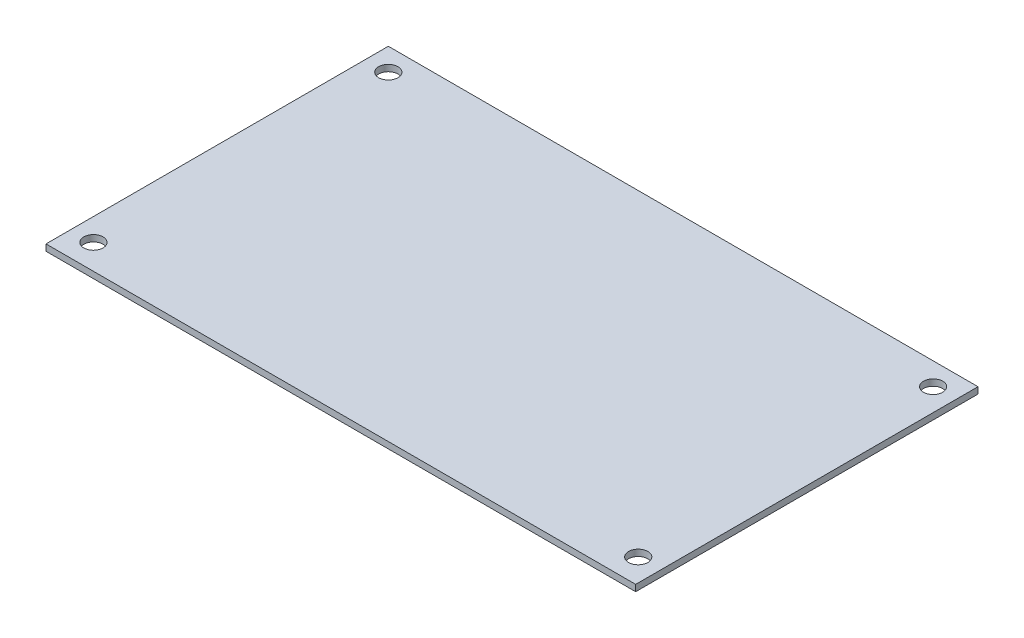
from build123d import *

# Parameters (mm, degrees)
SKETCH_1_W          = 92
SKETCH_1_H          = 53.41
EXTRUDE_1_DEPTH     = 1
SKETCH_2_R          = 1.5
CUT_EXTRUDE_1_DEPTH = 10


with BuildPart() as part:
    # Эскиз1 → Бобышка-Вытянуть1 (new body)
    with BuildSketch(Plane(origin=(0, 0, 0), x_dir=(1, 0, 0), z_dir=(0, 1, 0))):
        Rectangle(SKETCH_1_W, SKETCH_1_H)
    extrude(amount=EXTRUDE_1_DEPTH)

    # Эскиз2 → Вырез-Вытянуть1 (cut)
    with BuildSketch(Plane(origin=(0, 1, 0), x_dir=(1, 0, 0), z_dir=(0, 1, 0))):
        with Locations((-42.5, 23.20107425)):
            Circle(SKETCH_2_R)
        with Locations((42.5, 23.20072575)):
            Circle(SKETCH_2_R)
        with Locations((-42.5, -22.805)):
            Circle(SKETCH_2_R)
        with Locations((42.5, -22.805)):
            Circle(SKETCH_2_R)
    extrude(amount=-CUT_EXTRUDE_1_DEPTH, mode=Mode.SUBTRACT)


solid = part.part
